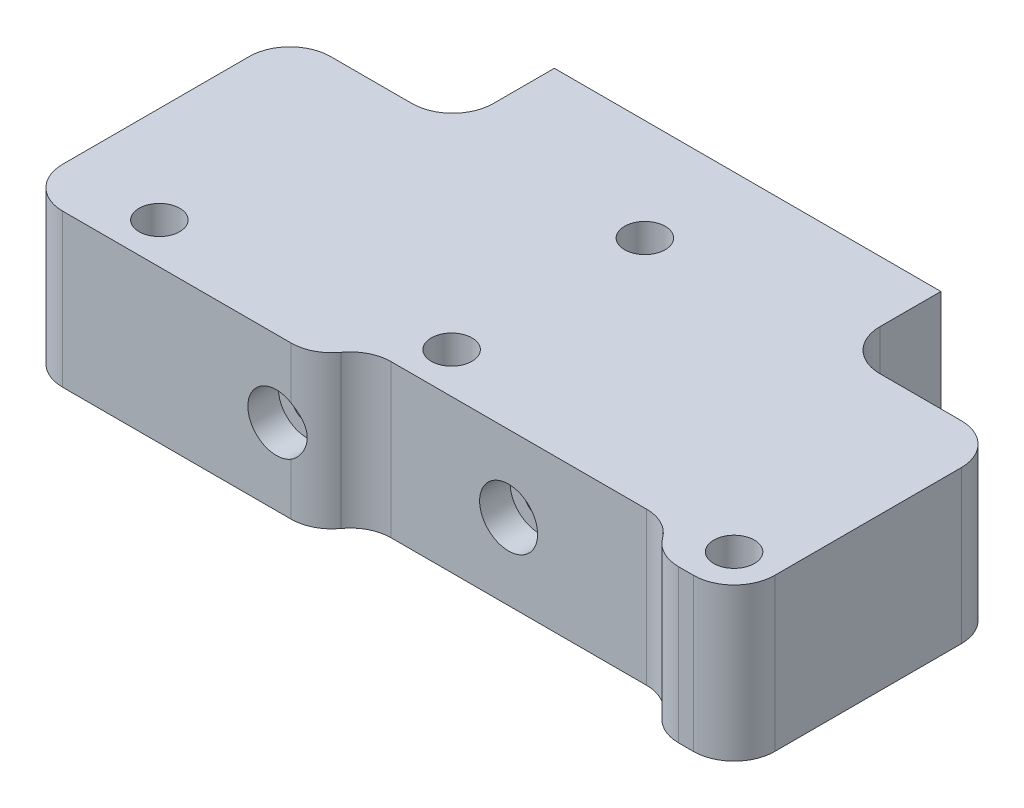
from build123d import *

# Parameters (mm, degrees)
SKETCH1_W           = 70
SKETCH1_H           = 34
SKETCH1_R           = 2
BOSS_EXTRUDE1_DEPTH = 15
SKETCH6_W           = 70
SKETCH6_H           = 15
BOSS_EXTRUDE2_DEPTH = 5
SKETCH3_R           = 2
CUT_EXTRUDE2_DEPTH  = 15
SKETCH8_W           = 6
SKETCH8_H           = 5
CUT_EXTRUDE3_DEPTH  = 15
SKETCH9_W           = 12
SKETCH9_H           = 6
CUT_EXTRUDE4_DEPTH  = 15
SKETCH10_W          = 16
SKETCH10_H          = 10
CUT_EXTRUDE5_DEPTH  = 17
SKETCH12_R          = 1.5
CUT_EXTRUDE6_DEPTH  = 41
SKETCH13_W          = 27.5
SKETCH13_H          = 6
CUT_EXTRUDE7_DEPTH  = 20
SKETCH14_W          = 13.5
SKETCH14_H          = 2.67
SKETCH14_W_2        = 29
CUT_EXTRUDE8_DEPTH  = 17
FILLET2_R           = 4
SKETCH16_W          = 5.5
SKETCH16_H          = 3.33
CUT_EXTRUDE10_DEPTH = 18
FILLET4_R           = 4
FILLET5_R           = 4
SKETCH17_R          = 2.85
CUT_EXTRUDE11_DEPTH = 3
SKETCH18_R          = 2.8
CUT_EXTRUDE12_DEPTH = 3
CHAMFER1_SIZE       = 2
CHAMFER2_SIZE       = 2


# Some blends are built 0.0001 mm under size
with BuildPart() as part:
    # Sketch1 → Boss-Extrude1 (new body)
    with BuildSketch(Plane(origin=(0, 0, 0), x_dir=(1, 0, 0), z_dir=(0, 1, 0))):
        with Locations((-35, 17)):
            Rectangle(SKETCH1_W, SKETCH1_H)
        with Locations(Location((-35.1, 24, 0), (0, 0, 270))):
            Circle(SKETCH1_R, mode=Mode.SUBTRACT)
        with Locations(Location((-35.1, 5, 0), (0, 0, 270))):
            Circle(SKETCH1_R, mode=Mode.SUBTRACT)
    extrude(amount=BOSS_EXTRUDE1_DEPTH)

    # Sketch6 → Boss-Extrude2 (add)
    with BuildSketch(Plane.XY):
        with Locations((-35, 7.5)):
            Rectangle(SKETCH6_W, SKETCH6_H)
    extrude(amount=BOSS_EXTRUDE2_DEPTH)

    # Sketch3 → Cut-Extrude2 (cut)
    with BuildSketch(Plane(origin=(0, 15, 0), x_dir=(1, 0, 0), z_dir=(0, 1, 0))):
        with Locations(Location((-4, 1.67, 0), (0, 0, 270))):
            Circle(SKETCH3_R)
        with Locations(Location((-60.5, 1.67, 0), (0, 0, 270))):
            Circle(SKETCH3_R)
    extrude(amount=-CUT_EXTRUDE2_DEPTH, mode=Mode.SUBTRACT)

    # Sketch8 → Cut-Extrude3 (cut)
    with BuildSketch(Plane(origin=(0, 15, 0), x_dir=(1, 0, 0), z_dir=(0, 1, 0))):
        with Locations((-16.5, -2.5)):
            Rectangle(SKETCH8_W, SKETCH8_H)
    extrude(amount=-CUT_EXTRUDE3_DEPTH, mode=Mode.SUBTRACT)

    # Sketch9 → Cut-Extrude4 (cut)
    with BuildSketch(Plane(origin=(0, 15, 0), x_dir=(1, 0, 0), z_dir=(0, 1, 0))):
        with Locations((-35, -2)):
            Rectangle(SKETCH9_W, SKETCH9_H)
    extrude(amount=-CUT_EXTRUDE4_DEPTH, mode=Mode.SUBTRACT)

    # Sketch10 → Cut-Extrude5 (cut)
    with BuildSketch(Plane.XZ):
        with Locations((-8, -29)):
            Rectangle(SKETCH10_W, SKETCH10_H)
        with Locations((-62, -29)):
            Rectangle(SKETCH10_W, SKETCH10_H)
    extrude(amount=-CUT_EXTRUDE5_DEPTH, mode=Mode.SUBTRACT)

    # Sketch12 → Cut-Extrude6 (cut)
    with BuildSketch(Plane.XY.offset(5)):
        with Locations((-45, 7.5)):
            Circle(SKETCH12_R)
        with Locations((-25.499999999, 7.499999999)):
            Circle(SKETCH12_R)
    extrude(amount=-CUT_EXTRUDE6_DEPTH, mode=Mode.SUBTRACT)

    # Sketch13 → Cut-Extrude7 (cut)
    with BuildSketch(Plane(origin=(0, 15, 0), x_dir=(1, 0, 0), z_dir=(0, 1, 0))):
        with Locations((-27.25, -2)):
            Rectangle(SKETCH13_W, SKETCH13_H)
    extrude(amount=-CUT_EXTRUDE7_DEPTH, mode=Mode.SUBTRACT)

    # Sketch14 → Cut-Extrude8 (cut)
    with BuildSketch(Plane(origin=(0, 0, 0), x_dir=(-1, 0, 0), z_dir=(0, -1, 0))):
        with Locations((6.75, -3.665)):
            Rectangle(SKETCH14_W, SKETCH14_H)
        with Locations((55.5, -3.665)):
            Rectangle(SKETCH14_W_2, SKETCH14_H)
    extrude(amount=-CUT_EXTRUDE8_DEPTH, mode=Mode.SUBTRACT)

    # Fillet2
    fillet2_edges = [part.edges().sort_by_distance(p)[0] for p in [
        (0, 7.5, 2.33),
        (-70, 7.5, 2.33),
        (-70, 7.5, -24),
        (0, 7.5, -24),
    ]]
    fillet(fillet2_edges, radius=FILLET2_R)

    # Sketch16 → Cut-Extrude10 (cut)
    with BuildSketch(Plane.XZ):
        with Locations((-10.75, 0.665)):
            Rectangle(SKETCH16_W, SKETCH16_H)
    extrude(amount=-CUT_EXTRUDE10_DEPTH, mode=Mode.SUBTRACT)

    # Fillet4
    # the kernel refuses this fillet: 4 mm, written as the material it adds along each edge
    with BuildSketch(Plane(origin=(-16, 0, -24), x_dir=(1, 0, 0), z_dir=(0, 1, 0)), Plane(origin=(-54, 0, -24), x_dir=(0, 0, -1), z_dir=(0, 1, 0))) as fillet4_piece_1:
        with BuildLine():
            CenterArc((FILLET4_R, FILLET4_R), FILLET4_R, 180, 90)
            Line((0, FILLET4_R), (-FILLET4_R * 0.02, FILLET4_R))
            Line((-FILLET4_R * 0.02, FILLET4_R), (-FILLET4_R * 0.02, -FILLET4_R * 0.02))
            Line((-FILLET4_R * 0.02, -FILLET4_R * 0.02), (FILLET4_R, -FILLET4_R * 0.02))
            Line((FILLET4_R, -FILLET4_R * 0.02), (FILLET4_R, 0))
        make_face()
    extrude(amount=15)
    with BuildSketch(Plane(origin=(-41, 15, -1), x_dir=(0, 0, 1), z_dir=(0, -1, 0))) as fillet4_piece_2:
        with BuildLine():
            CenterArc((4, -3.943488304), FILLET4_R, 99.642495459, 80.357504541)
            Line((0, -3.943488304), (-0.08, -3.943488304))
            Line((-0.08, -3.943488304), (-0.08, 0))
            Line((-0.08, 0), (0, 0.08))
            ThreePointArc((0, 0.08), (1.665, 0.08), (3.3166, 0.078869766))
            Line((3.3166, 0.078869766), (3.33, 0))
        make_face()
    extrude(amount=15)
    with BuildSketch(Plane(origin=(-8, 0, -1), x_dir=(-1.0, 0, -8.691057696161095e-11), z_dir=(0, 1, 0))) as fillet4_piece_3:
        with BuildLine():
            CenterArc((3.943488303, 4), FILLET4_R, 189.642495464, 80.357504541)
            Line((0, 3.33), (-0.078869766, 3.3166))
            ThreePointArc((-0.078869766, 3.3166), (-0.08, 1.665), (-0.08, 0))
            Line((-0.08, 0), (0, -0.08))
            Line((0, -0.08), (3.943488304, -0.08))
            Line((3.943488304, -0.08), (3.943488304, 0))
        make_face()
    extrude(amount=15)

    # Fillet5
    fillet5_edges = [part.edges().sort_by_distance(p)[0] for p in [
        (-41, 7.5, 2.33),
        (-8, 7.5, 2.33),
    ]]
    fillet(fillet5_edges, radius=FILLET5_R)

    # Sketch17 → Cut-Extrude11 (cut)
    with BuildSketch(Plane.XY.offset(-1)):
        with Locations((-25.499999999, 7.499999999)):
            Circle(SKETCH17_R)
    extrude(amount=-CUT_EXTRUDE11_DEPTH, mode=Mode.SUBTRACT)

    # Sketch18 → Cut-Extrude12 (cut)
    with BuildSketch(Plane.XY.offset(2.33)):
        with Locations((-45, 7.5)):
            Circle(SKETCH18_R)
    extrude(amount=-CUT_EXTRUDE12_DEPTH, mode=Mode.SUBTRACT)

    # Chamfer1
    chamfer1_edges = [part.edges().sort_by_distance(p)[0] for p in [
        (-35.1, 0, -26),
    ]]
    chamfer(chamfer1_edges, length=CHAMFER1_SIZE)

    # Chamfer2
    chamfer2_edges = [part.edges().sort_by_distance(p)[0] for p in [
        (-35.1, 0, -7),
    ]]
    chamfer(chamfer2_edges, length=CHAMFER2_SIZE - 0.0001)  # a hair under: the kernel refuses the full size


solid = part.part
